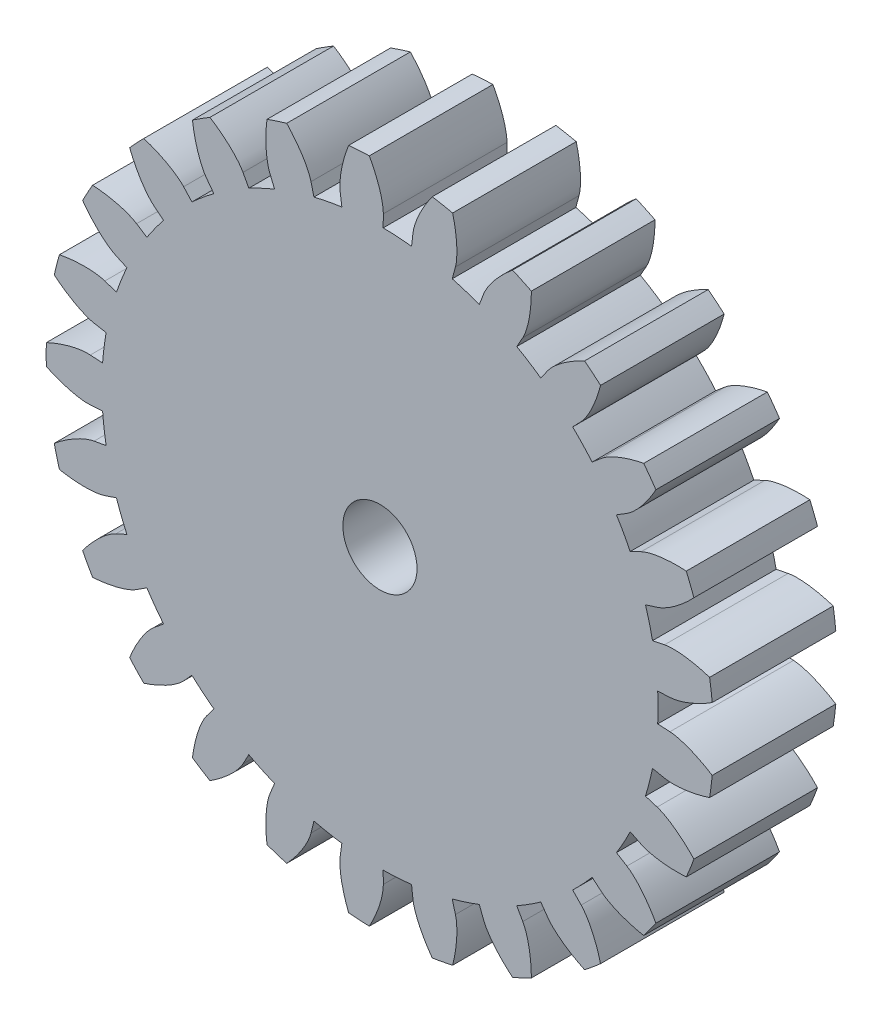
from build123d import *

# Parameters (mm, degrees)
SKETCH_1_R               = 13.5
SKETCH_1_R_2             = 1.5
EXTRUDE_1_DEPTH          = 5
CUT_EXTRUDE_1_DEPTH      = 20.735754356
PATTERN_CIRCULAR_1_COUNT = 25
PATTERN_CIRCULAR_1_ANGLE = 345.6


with BuildPart() as part:
    # 草图1 → 凸台-拉伸1 (new body)
    with BuildSketch(Plane.XY):
        Circle(SKETCH_1_R)
        Circle(SKETCH_1_R_2, mode=Mode.SUBTRACT)
    extrude(amount=EXTRUDE_1_DEPTH)

    # 草图1<3> → 切除-拉伸1 (cut, through all)
    with BuildSketch(Plane.XY):
        with BuildLine():
            Line((11.730793662, 0.600584865), (11.235284882, 0.575216158))
            ThreePointArc((11.235284882, 0.575216158), (11.246320619, 0.287702174), (11.25, 0))
            ThreePointArc((11.25, 0), (11.246320619, -0.287702174), (11.235284882, -0.575216158))
            Line((11.235284882, -0.575216158), (11.730793662, -0.600584865))
            add(Edge.make_bspline(
                [(11.730793662, -0.600584865), (11.775456213, -0.602871467), (11.864323988, -0.61161083), (12.031646502, -0.643255468), (12.273517711, -0.709278533), (12.66800179, -0.851104438), (13.004851693, -1.015658352), (13.259698023, -1.161601678), (13.439641435, -1.275161985)],
                knots=[0, 0, 0, 0, 0, 0.002802034, 0.005604068, 0.010661158, 0.015718248, 0.029067116, 0.029067116, 0.029067116, 0.029067116, 0.029067116], degree=4))
            ThreePointArc((13.439641435, -1.275161985), (13.484901916, -0.638294847), (13.5, 0))
            ThreePointArc((13.5, 0), (13.484901916, 0.638294847), (13.439641435, 1.275161985))
            add(Edge.make_bspline(
                [(11.730793662, 0.600584865), (11.775456213, 0.602871467), (11.864323988, 0.61161083), (12.031646502, 0.643255468), (12.273517711, 0.709278533), (12.66800179, 0.851104438), (13.004851693, 1.015658352), (13.259698023, 1.161601678), (13.439641435, 1.275161985)],
                knots=[0, 0, 0, 0, 0, 0.002802034, 0.005604068, 0.010661158, 0.015718248, 0.029067116, 0.029067116, 0.029067116, 0.029067116, 0.029067116], degree=4))
        make_face()
    cut_extrude_1 = extrude(amount=CUT_EXTRUDE_1_DEPTH, mode=Mode.SUBTRACT)

    # 阵列(圆周)1: 切除-拉伸1 ×25 about axis
    pattern_circular_1_axis = Axis((0, 0, 5), (0, 0, 1))
    for i in range(1, PATTERN_CIRCULAR_1_COUNT):
        add(cut_extrude_1.rotate(pattern_circular_1_axis, i * PATTERN_CIRCULAR_1_ANGLE / (PATTERN_CIRCULAR_1_COUNT - 1)), mode=Mode.SUBTRACT)


solid = part.part
